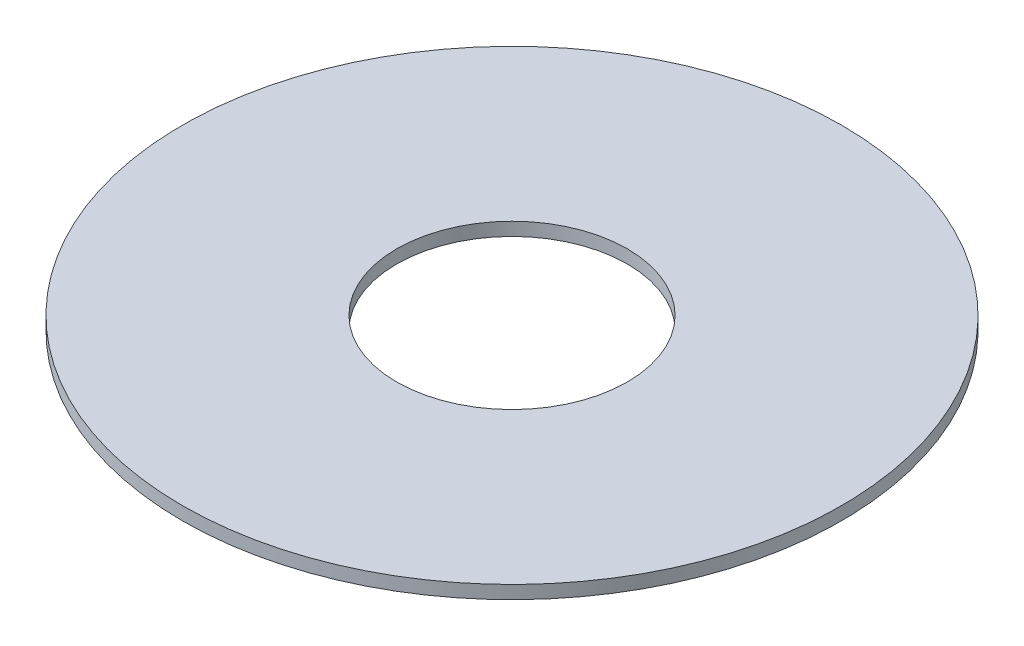
from build123d import *

# Parameters (mm, degrees)
SKETCH1_R           = 100
BOSS_EXTRUDE1_DEPTH = 4
SKETCH2_R           = 35
CUT_EXTRUDE1_DEPTH  = 142.477913471


with BuildPart() as part:
    # Sketch1 → Boss-Extrude1 (new body)
    with BuildSketch(Plane(origin=(0, 0, 0), x_dir=(1, 0, 0), z_dir=(0, 1, 0))):
        Circle(SKETCH1_R)
    extrude(amount=BOSS_EXTRUDE1_DEPTH)

    # Sketch2 → Cut-Extrude1 (cut, through all)
    with BuildSketch(Plane(origin=(0, 0, 0), x_dir=(1, 0, 0), z_dir=(0, 1, 0))):
        Circle(SKETCH2_R)
    extrude(amount=CUT_EXTRUDE1_DEPTH, mode=Mode.SUBTRACT)


solid = part.part
